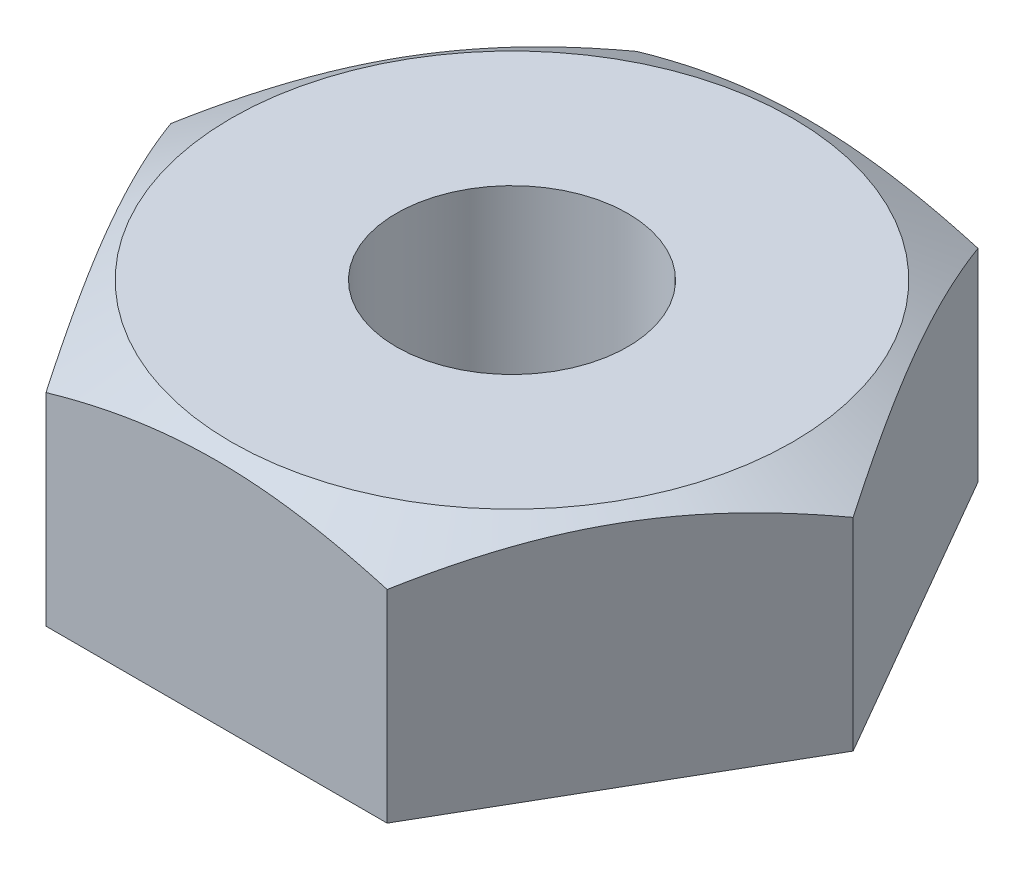
from build123d import *

# Parameters (mm, degrees)
SKETCH1_R          = 0.78
BASE_EXTRUDE_DEPTH = 1.6


# Read off the part's stored shape, not the designer's step: Cut-Extrude1
with BuildPart() as part:
    # Sketch1 → Base-Extrude (new body)
    with BuildSketch(Plane(origin=(0, 0, 0), x_dir=(1, 0, 0), z_dir=(0, 1, 0))):
        Polygon((-1.15, 1.991858429), (1.15, 1.991858429), (2.3, 0), (1.15, -1.991858429), (-1.15, -1.991858429), (-2.3, 0), align=None)
        with Locations(Location((0, 0, 0), (0, 0, 270))):
            Circle(SKETCH1_R, mode=Mode.SUBTRACT)
    extrude(amount=BASE_EXTRUDE_DEPTH)

    # Cut-Extrude1 outline → Cut-Extrude1 (revolve, cut)
    with BuildSketch(Plane.XY):
        Polygon((2.3, 1.6), (1.891858429, 1.6), (2.3, 1.364359354), align=None)
    revolve(axis=Axis((0, 0, 0), (0, 1, 0)), mode=Mode.SUBTRACT)


solid = part.part
